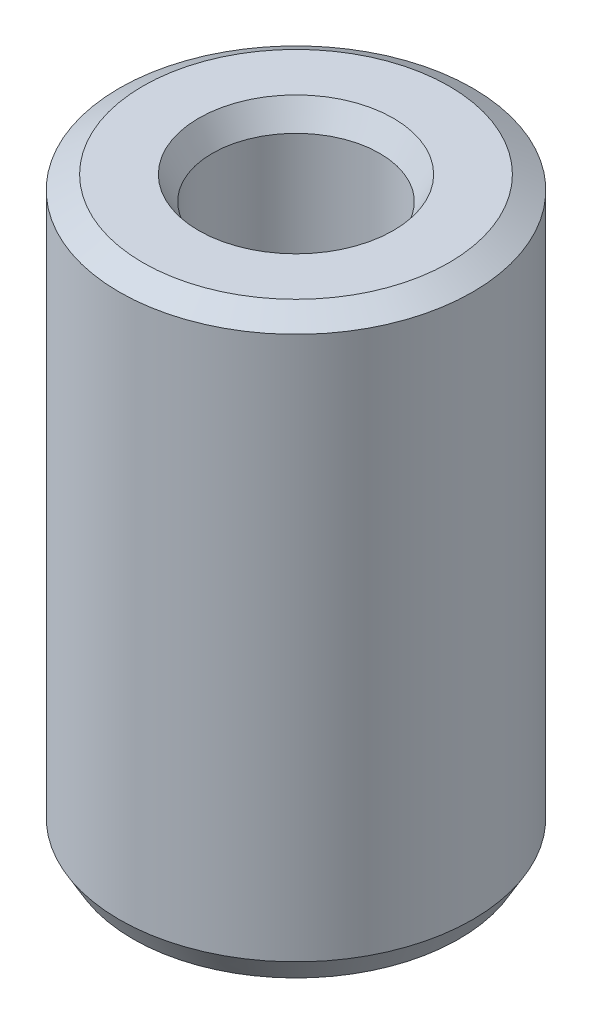
from build123d import *
from OCP.BRepFilletAPI import BRepFilletAPI_MakeChamfer

# Parameters (mm, degrees)
SKETCH1_R           = 35
BOSS_EXTRUDE1_DEPTH = 115.049599354
SKETCH2_R           = 16.586109231
CUT_EXTRUDE1_DEPTH  = 126.245400361
CHAMFER1_SIZE       = 2.701651908
CHAMFER1_SIZE2      = 4.679398368


with BuildPart() as part:
    # Sketch1 → Boss-Extrude1 (new body)
    with BuildSketch(Plane(origin=(0, 0, 0), x_dir=(1, 0, 0), z_dir=(0, 1, 0))):
        Circle(SKETCH1_R)
    extrude(amount=BOSS_EXTRUDE1_DEPTH)

    # Sketch2 → Cut-Extrude1 (cut, through all)
    with BuildSketch(Plane(origin=(0, 0, 0), x_dir=(1, 0, 0), z_dir=(0, 1, 0))):
        Circle(SKETCH2_R)
    extrude(amount=CUT_EXTRUDE1_DEPTH, mode=Mode.SUBTRACT)

    # Chamfer1: one chamfer whose edges measure the first distance from different faces: ONE call of the kernel's chamfer builder (chamfer() names one face for all edges)
    chamfer1_edges_1 = [part.edges().sort_by_distance(p)[0] for p in [
        (-16.586109231, 115.049599354, 0),
    ]]
    chamfer1_side_1 = [part.faces().sort_by_distance(p)[0] for p in [
        (-34.010050506, 115.049599354, 0),
    ]]
    chamfer1_edges_2 = [part.edges().sort_by_distance(p)[0] for p in [
        (-16.586109231, 0, 0),
    ]]
    chamfer1_side_2 = [part.faces().sort_by_distance(p)[0] for p in [
        (-16.586109231, 57.524799677, 0),
    ]]
    chamfer1_edges_3 = [part.edges().sort_by_distance(p)[0] for p in [
        (-35, 0, 0),
    ]]
    chamfer1_side_3 = [part.faces().sort_by_distance(p)[0] for p in [
        (-34.010050506, 0, 0),
    ]]
    chamfer1_edges_4 = [part.edges().sort_by_distance(p)[0] for p in [
        (-35, 115.049599354, 0),
    ]]
    chamfer1_side_4 = [part.faces().sort_by_distance(p)[0] for p in [
        (-35, 57.524799677, 0),
    ]]
    chamfer1 = BRepFilletAPI_MakeChamfer(part.part.solid().wrapped)
    for e in chamfer1_edges_1:
        chamfer1.Add(CHAMFER1_SIZE, CHAMFER1_SIZE2, e.wrapped, chamfer1_side_1[0].wrapped)  # the first distance lies on this face
    for e in chamfer1_edges_2:
        chamfer1.Add(CHAMFER1_SIZE, CHAMFER1_SIZE2, e.wrapped, chamfer1_side_2[0].wrapped)  # the first distance lies on this face
    for e in chamfer1_edges_3:
        chamfer1.Add(CHAMFER1_SIZE, CHAMFER1_SIZE2, e.wrapped, chamfer1_side_3[0].wrapped)  # the first distance lies on this face
    for e in chamfer1_edges_4:
        chamfer1.Add(CHAMFER1_SIZE, CHAMFER1_SIZE2, e.wrapped, chamfer1_side_4[0].wrapped)  # the first distance lies on this face
    add(Compound.cast(chamfer1.Shape()), mode=Mode.REPLACE)


solid = part.part
